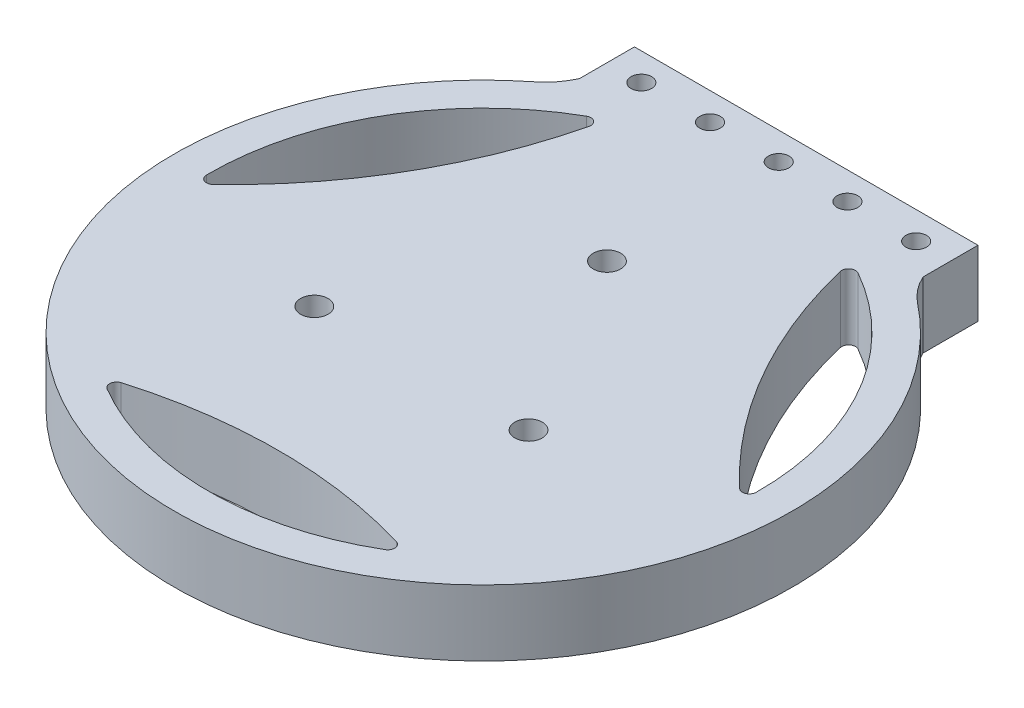
from build123d import *

# Parameters (mm, degrees)
SKETCH1_R                    = 37.5
BOSS_EXTRUDE1_DEPTH          = 9.6
CUT_EXTRUDE2_START           = -9.6
CUT_EXTRUDE2_DEPTH           = 9.6
SKETCH4_R                    = 45
SKETCH4_R_2                  = 37.5
BOSS_EXTRUDE2_DEPTH          = 9.6
BOSS_EXTRUDE3_START          = -8.6
BOSS_EXTRUDE3_DEPTH          = 8.6
SKETCH7_R                    = 2
CUT_EXTRUDE3_DEPTH           = 65.359614666
SKETCH14_R                   = 5
SKETCH14_R_2                 = 2
BOSS_EXTRUDE5_DEPTH          = 1.5
CHAMFER1_SIZE                = 1.5
CIRPATTERN2_COUNT            = 3
CHAMFER1_OF_CIRPATTERN2_SIZE = 1.5
BOSS_EXTRUDE4_START          = -9.6
BOSS_EXTRUDE4_DEPTH          = 9.6
FILLET1_R                    = 10
SKETCH12_R                   = 1.5
CUT_EXTRUDE6_DEPTH           = 66.773550915
LPATTERN1_COUNT              = 10
LPATTERN1_PITCH              = 10
CUT_EXTRUDE7_DEPTH           = 66.773550915
FILLET3_R                    = 1
CIRPATTERN3_COUNT            = 3
FILLET3_OF_CIRPATTERN3_R     = 1


# Read off the part's stored shape, not the designer's step: Cut-Extrude2
# Some blends are built 0.0001 mm under size
with BuildPart() as part:
    # Sketch1 → Boss-Extrude1 (new body)
    with BuildSketch(Plane(origin=(0, 0, 0), x_dir=(1, 0, 0), z_dir=(0, 1, 0))):
        with Locations(Location((0, 0, 0), (0, 0, 270))):
            Circle(SKETCH1_R)
    extrude(amount=BOSS_EXTRUDE1_DEPTH)

    # Cut-Extrude2 outline → Cut-Extrude2 (cut)
    with BuildSketch(Plane(origin=(0, 9.6, 0), x_dir=(1, 0, 0), z_dir=(0, 1, 0)).offset(CUT_EXTRUDE2_START)):
        with BuildLine():
            ThreePointArc((-24.104535363, -28.726666617), (0, -24.760936498), (24.104535363, -28.726666617))
            ThreePointArc((24.104535363, -28.726666617), (32.475952642, -18.75), (36.930290738, -6.511806663))
            ThreePointArc((36.930290738, -6.511806663), (21.443600029, 12.380468249), (12.825755375, 35.238473279))
            ThreePointArc((12.825755375, 35.238473279), (0, 37.5), (-12.825755375, 35.238473279))
            ThreePointArc((-12.825755375, 35.238473279), (-21.443600029, 12.380468249), (-36.930290738, -6.511806663))
            ThreePointArc((-36.930290738, -6.511806663), (-32.475952642, -18.75), (-24.104535363, -28.726666617))
        make_face()
    extrude(amount=CUT_EXTRUDE2_DEPTH, mode=Mode.SUBTRACT)

    # Sketch4 → Boss-Extrude2 (add)
    with BuildSketch(Plane(origin=(0, 0, 0), x_dir=(1, 0, 0), z_dir=(0, 1, 0))):
        with Locations(Location((0, 0, 0), (0, 0, 270))):
            Circle(SKETCH4_R)
        Circle(SKETCH4_R_2, mode=Mode.SUBTRACT)
    extrude(amount=BOSS_EXTRUDE2_DEPTH)

    # Sketch6 → Boss-Extrude3 (add)
    with BuildSketch(Plane(origin=(0, 9.6, 0), x_dir=(1, 0, 0), z_dir=(0, 1, 0)).offset(BOSS_EXTRUDE3_START)):
        with BuildLine():
            ThreePointArc((24.104535363, -28.726666617), (32.475952642, -18.75), (36.930290738, -6.511806663))
            ThreePointArc((36.930290738, -6.511806663), (21.443600029, 12.380468249), (12.825755375, 35.238473279))
            ThreePointArc((12.825755375, 35.238473279), (0, 37.5), (-12.825755375, 35.238473279))
            ThreePointArc((-12.825755375, 35.238473279), (-21.443600029, 12.380468249), (-36.930290738, -6.511806663))
            ThreePointArc((-36.930290738, -6.511806663), (-32.475952642, -18.75), (-24.104535363, -28.726666617))
            ThreePointArc((-24.104535363, -28.726666617), (0, -24.760936498), (24.104535363, -28.726666617))
        make_face()
    extrude(amount=BOSS_EXTRUDE3_DEPTH)

    # Sketch7 → Cut-Extrude3 (cut, through all)
    with BuildSketch(Plane(origin=(0, 9.6, 0), x_dir=(1, 0, 0), z_dir=(0, 1, 0))):
        with Locations(Location((0, 18, 0), (0, 0, 270))):
            Circle(SKETCH7_R)
    cut_extrude3 = extrude(amount=-CUT_EXTRUDE3_DEPTH, mode=Mode.SUBTRACT)

    # Sketch14 → Boss-Extrude5 (add)
    with BuildSketch(Plane.XZ.offset(-1)):
        with Locations(Location((0, -18, 0), (0, 0, 90))):
            Circle(SKETCH14_R)
        with Locations(Location((0, -18, 0), (0, 0, 90))):
            Circle(SKETCH14_R_2, mode=Mode.SUBTRACT)
    boss_extrude5 = extrude(amount=BOSS_EXTRUDE5_DEPTH)

    # Chamfer1
    chamfer1_edges = [part.edges().sort_by_distance(p)[0] for p in [
        (0, 1, -23),
    ]]
    chamfer(chamfer1_edges, length=CHAMFER1_SIZE - 0.0001)  # a hair under: the kernel refuses the full size

    # CirPattern2: Cut-Extrude3, Boss-Extrude5 ×3 about axis
    cirpattern2_axis = Axis((0, 0, 0), (0, 1, 0))
    add([cut_extrude3.rotate(cirpattern2_axis, i * 360 / CIRPATTERN2_COUNT) for i in range(1, CIRPATTERN2_COUNT)], mode=Mode.SUBTRACT)
    add([boss_extrude5.rotate(cirpattern2_axis, i * 360 / CIRPATTERN2_COUNT) for i in range(1, CIRPATTERN2_COUNT)])

    # Chamfer1 of CirPattern2
    chamfer1_of_cirpattern2_edges = [part.edges().sort_by_distance(p)[0] for p in [
        (-19.918584287, 1, 11.5),
        (19.918584287, 1, 11.5),
    ]]
    chamfer(chamfer1_of_cirpattern2_edges, length=CHAMFER1_OF_CIRPATTERN2_SIZE - 0.0001)  # a hair under: the kernel refuses the full size

    # Sketch11 → Boss-Extrude4 (add)
    with BuildSketch(Plane(origin=(0, 9.6, 0), x_dir=(1, 0, 0), z_dir=(0, 1, 0)).offset(BOSS_EXTRUDE4_START)):
        with BuildLine():
            ThreePointArc((-22.449944321, 39), (0, 45), (22.449944321, 39))
            Line((22.449944321, 39), (25, 39))
            Line((25, 39), (25, 47))
            Line((25, 47), (-25, 47))
            Line((-25, 47), (-25, 39))
            Line((-25, 39), (-22.449944321, 39))
        make_face()
    extrude(amount=BOSS_EXTRUDE4_DEPTH)

    # Fillet1
    # the kernel refuses this fillet: 10 mm, written as the material it adds along each edge
    with BuildSketch(Plane(origin=(-22.449944321, 0, -39), x_dir=(-1, 0, 0), z_dir=(0, 1, 0))) as fillet1_piece_1:
        with BuildLine():
            CenterArc((11.645047875, -4.157056285), FILLET1_R, 128.309485754, 27.126753117)
            ThreePointArc((5.445958385, 3.689681222), (2.79048981, 1.745195143), (0, 0))
            Line((0, 0), (2.550055679, 0))
        make_face()
    extrude(amount=9.6)
    with BuildSketch(Plane(origin=(22.449944321, 0, -39), x_dir=(1, 0, 0), z_dir=(0, 1, 0))) as fillet1_piece_2:
        with BuildLine():
            CenterArc((11.645047875, 4.157056285), FILLET1_R, 204.563761129, 27.126753117)
            ThreePointArc((5.445958385, -3.689681222), (2.79048981, -1.745195143), (0, 0))
            Line((0, 0), (2.550055679, 0))
        make_face()
    extrude(amount=9.6)

    # Sketch12 → Cut-Extrude6 (cut, through all)
    with BuildSketch(Plane.XZ):
        with Locations(Location((-20, -43, 0), (0, 0, 270))):
            Circle(SKETCH12_R)
    cut_extrude6 = extrude(amount=-CUT_EXTRUDE6_DEPTH, mode=Mode.SUBTRACT)

    # LPattern1: Cut-Extrude6 ×10
    with Locations(*[(i * LPATTERN1_PITCH, 0, 0) for i in range(1, LPATTERN1_COUNT)]):
        add(cut_extrude6, mode=Mode.SUBTRACT)

    # Sketch13 → Cut-Extrude7 (cut, through all)
    with BuildSketch(Plane.XZ):
        with BuildLine():
            ThreePointArc((-22.11228446, 33.332369792), (0, 29.760936498), (22.11228446, 33.332369792))
            ThreePointArc((22.11228446, 33.332369792), (0, 40), (-22.11228446, 33.332369792))
        make_face()
    cut_extrude7 = extrude(amount=-CUT_EXTRUDE7_DEPTH, mode=Mode.SUBTRACT)

    # Fillet3
    fillet3_edges = [part.edges().sort_by_distance(p)[0] for p in [
        (-22.11228446, 4.8, 33.332369792),
        (22.11228446, 4.8, 33.332369792),
    ]]
    fillet(fillet3_edges, radius=FILLET3_R)

    # CirPattern3: Cut-Extrude7 ×3 about axis
    cirpattern3_axis = Axis((0, 0, 0), (0, 1, 0))
    for i in range(1, CIRPATTERN3_COUNT):
        add(cut_extrude7.rotate(cirpattern3_axis, i * 360 / CIRPATTERN3_COUNT), mode=Mode.SUBTRACT)

    # Fillet3 of CirPattern3
    fillet3_of_cirpattern3_edges = [part.edges().sort_by_distance(p)[0] for p in [
        (39.922821238, 4.8, 2.483615182),
        (17.810536778, 4.8, -35.815984974),
        (-17.810536778, 4.8, -35.815984974),
        (-39.922821238, 4.8, 2.483615182),
    ]]
    fillet(fillet3_of_cirpattern3_edges, radius=FILLET3_OF_CIRPATTERN3_R)


solid = part.part
